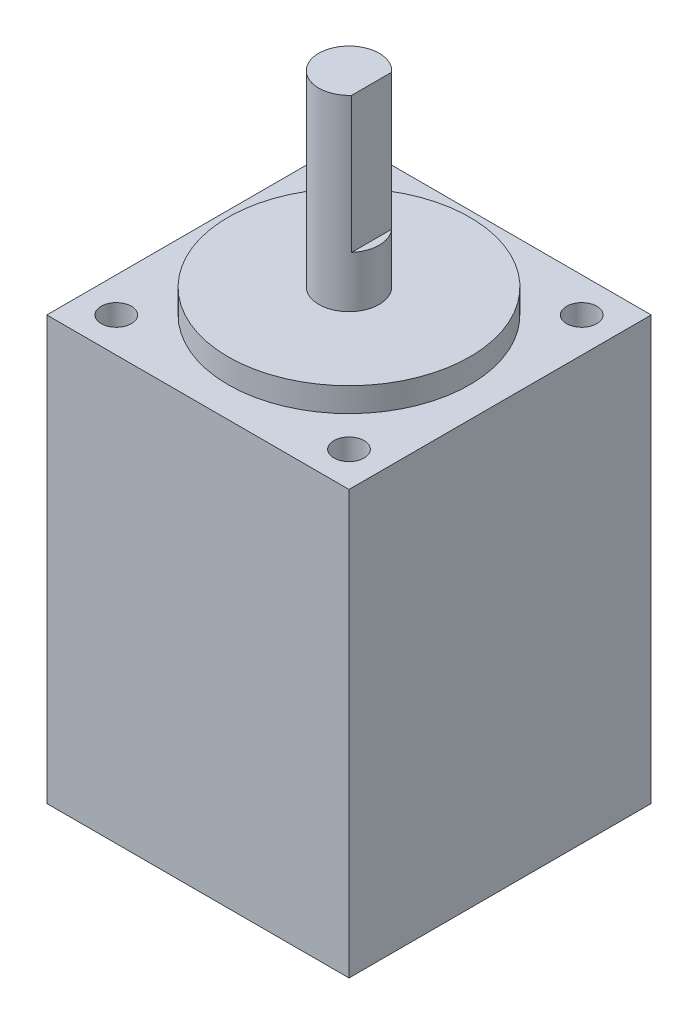
from build123d import *

# Parameters (mm, degrees)
SKETCH_1_W          = 20
SKETCH_1_H          = 20
SKETCH_1_R          = 1
EXTRUDE_1_DEPTH     = 28
SKETCH_2_R          = 8
EXTRUDE_2_DEPTH     = 1.6
SKETCH_3_R          = 2
EXTRUDE_3_DEPTH     = 12.4
CUT_EXTRUDE_START   = -9
CUT_EXTRUDE_4_DEPTH = 9


with BuildPart() as part:
    # 草图1 → 凸台-拉伸1 (new body)
    with BuildSketch(Plane(origin=(0, 0, 0), x_dir=(1, 0, 0), z_dir=(0, 1, 0))):
        with Locations((10, 10)):
            Rectangle(SKETCH_1_W, SKETCH_1_H)
        with Locations((17.7, 2.3)):
            Circle(SKETCH_1_R, mode=Mode.SUBTRACT)
        with Locations((17.7, 17.7)):
            Circle(SKETCH_1_R, mode=Mode.SUBTRACT)
        with Locations((2.3, 17.7)):
            Circle(SKETCH_1_R, mode=Mode.SUBTRACT)
        with Locations((2.3, 2.3)):
            Circle(SKETCH_1_R, mode=Mode.SUBTRACT)
    extrude(amount=EXTRUDE_1_DEPTH)

    # 草图2 → 凸台-拉伸2 (add)
    with BuildSketch(Plane(origin=(0, 28, 0), x_dir=(1, 0, 0), z_dir=(0, 1, 0))):
        with Locations((10, 10)):
            Circle(SKETCH_2_R)
    extrude(amount=EXTRUDE_2_DEPTH)

    # 草图3 → 凸台-拉伸3 (add)
    with BuildSketch(Plane(origin=(0, 29.6, 0), x_dir=(1, 0, 0), z_dir=(0, 1, 0))):
        with Locations((10, 10)):
            Circle(SKETCH_3_R)
    extrude(amount=EXTRUDE_3_DEPTH)

    # 草图4 → 切除-拉伸4 (cut)
    with BuildSketch(Plane(origin=(0, 42, 0), x_dir=(1, 0, 0), z_dir=(0, 1, 0)).offset(CUT_EXTRUDE_START)):
        with BuildLine():
            Line((11.501110762, 11.321615103), (11.501110762, 10))
            Line((11.501110762, 10), (11.501110762, 8.678384897))
            ThreePointArc((11.501110762, 8.678384897), (11.871125533, 9.293679083), (12, 10))
            ThreePointArc((12, 10), (11.871125533, 10.706320917), (11.501110762, 11.321615103))
        make_face()
    extrude(amount=CUT_EXTRUDE_4_DEPTH, mode=Mode.SUBTRACT)


solid = part.part
